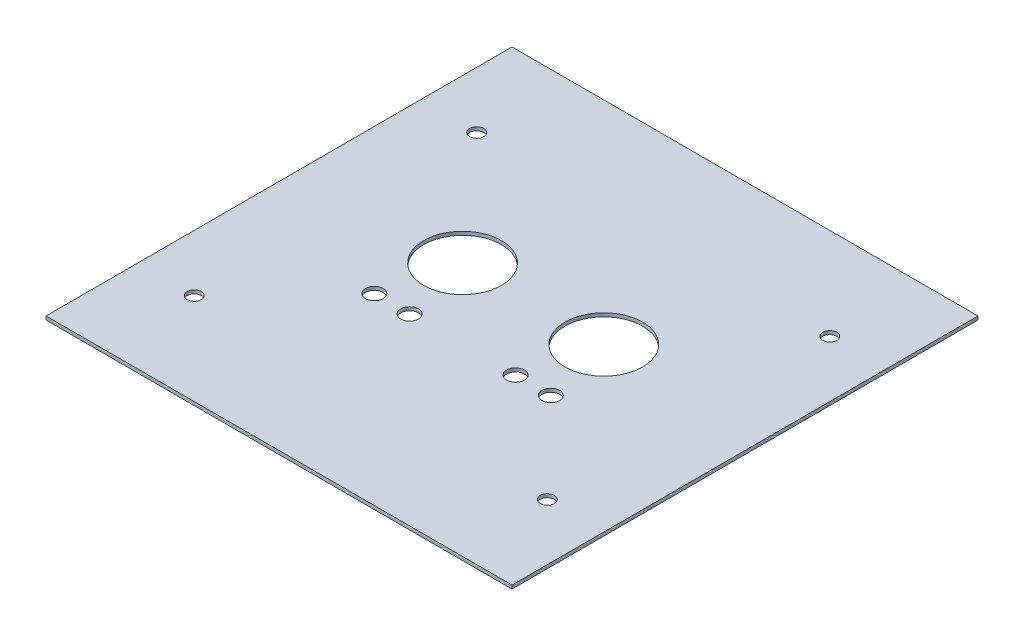
from build123d import *

# Parameters (mm, degrees)
SKETCH1_W           = 132
SKETCH1_H           = 132
SKETCH1_R           = 2.5
SKETCH1_R_2         = 11
BOSS_EXTRUDE1_DEPTH = 1
SKETCH2_R           = 2
CUT_EXTRUDE1_DEPTH  = 153.139625537


with BuildPart() as part:
    # Sketch1 → Boss-Extrude1 (new body)
    with BuildSketch(Plane(origin=(0, 0, 0), x_dir=(1, 0, 0), z_dir=(0, 1, 0))):
        with Locations((39.311456102, 43.795094937)):
            Rectangle(SKETCH1_W, SKETCH1_H)
        with Locations((14.311456102, 29.795094937)):
            Circle(SKETCH1_R, mode=Mode.SUBTRACT)
        with Locations((24.311456102, 29.795094937)):
            Circle(SKETCH1_R, mode=Mode.SUBTRACT)
        with Locations((54.311456102, 29.795094937)):
            Circle(SKETCH1_R, mode=Mode.SUBTRACT)
        with Locations((64.311456102, 29.795094937)):
            Circle(SKETCH1_R, mode=Mode.SUBTRACT)
        with Locations((19.311456102, 49.795094937)):
            Circle(SKETCH1_R_2, mode=Mode.SUBTRACT)
        with Locations((59.311456102, 49.795094937)):
            Circle(SKETCH1_R_2, mode=Mode.SUBTRACT)
    extrude(amount=BOSS_EXTRUDE1_DEPTH)

    # Sketch2 → Cut-Extrude1 (cut, through all)
    with BuildSketch(Plane.XZ):
        with Locations((-10.688543898, -3.795094937)):
            Circle(SKETCH2_R)
        with Locations((89.311456102, -3.795094937)):
            Circle(SKETCH2_R)
        with Locations((89.311456102, -83.795094937)):
            Circle(SKETCH2_R)
        with Locations((-10.688543898, -83.795094937)):
            Circle(SKETCH2_R)
    extrude(amount=-CUT_EXTRUDE1_DEPTH, mode=Mode.SUBTRACT)


solid = part.part
